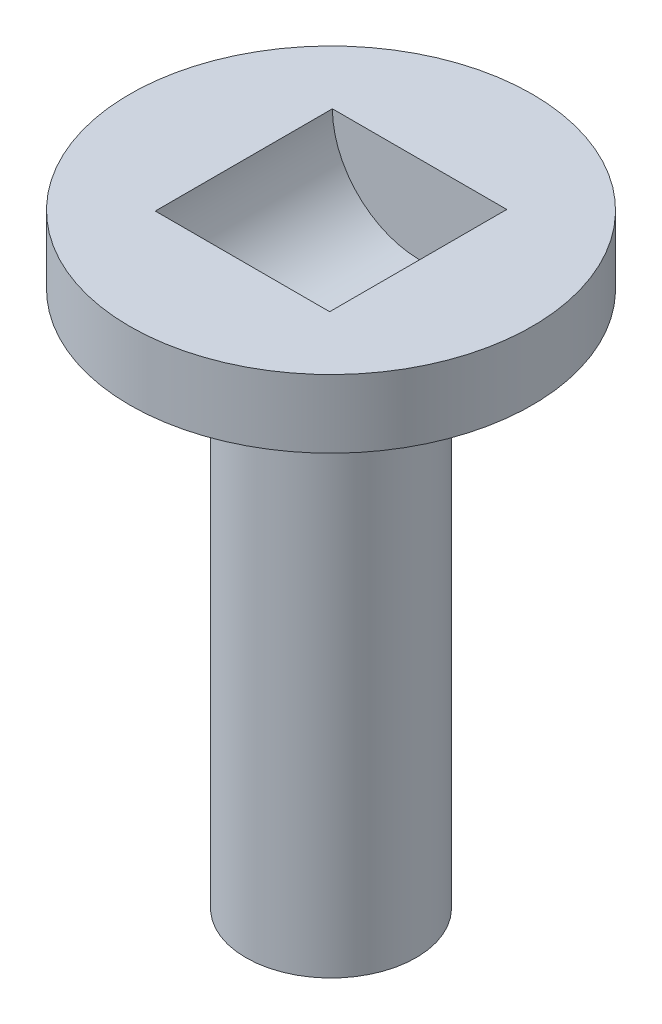
from build123d import *

# Parameters (mm, degrees)
SKETCH1_R               = 3.175
BOSS_EXTRUDE1_DEPTH     = 20
SKETCH2_R               = 1.35
CUT_EXTRUDE1_DEPTH      = 10
SKETCH4_R               = 7.5
BOSS_EXTRUDE2_DEPTH     = 2.54
SKETCH6_R               = 4.85
BOSS_EXTRUDE3_DEPTH     = 3.35
CUT_EXTRUDE3_DEPTH      = 3.3
CUT_EXTRUDE3_DEPTH_BACK = 3.302
SKETCH5_R               = 3.25


with BuildPart() as part:
    # Sketch1 → Boss-Extrude1 (new body)
    with BuildSketch(Plane(origin=(0, 0, 0), x_dir=(1, 0, 0), z_dir=(0, 1, 0))):
        Circle(SKETCH1_R)
    extrude(amount=BOSS_EXTRUDE1_DEPTH)

    # Sketch2 → Cut-Extrude1 (cut)
    with BuildSketch(Plane.XZ):
        Circle(SKETCH2_R)
    extrude(amount=-CUT_EXTRUDE1_DEPTH, mode=Mode.SUBTRACT)

    # Sketch4 → Boss-Extrude2 (add)
    with BuildSketch(Plane(origin=(0, 20, 0), x_dir=(1, 0, 0), z_dir=(0, 1, 0))):
        Circle(SKETCH4_R)
    extrude(amount=BOSS_EXTRUDE2_DEPTH)

    # Sketch6 → Boss-Extrude3 (add)
    with BuildSketch(Plane(origin=(0, 22.54, 0), x_dir=(1, 0, 0), z_dir=(0, 1, 0))):
        Circle(SKETCH6_R)
    extrude(amount=-BOSS_EXTRUDE3_DEPTH)

    # Sketch5 → Cut-Extrude3 (cut, two sides: drawn at the far end of the back side and taken through both)
    with BuildSketch(Plane.XY.offset(-CUT_EXTRUDE3_DEPTH_BACK)):
        with Locations((0, 22.54)):
            Circle(SKETCH5_R)
    extrude(amount=CUT_EXTRUDE3_DEPTH + CUT_EXTRUDE3_DEPTH_BACK, mode=Mode.SUBTRACT)


solid = part.part
